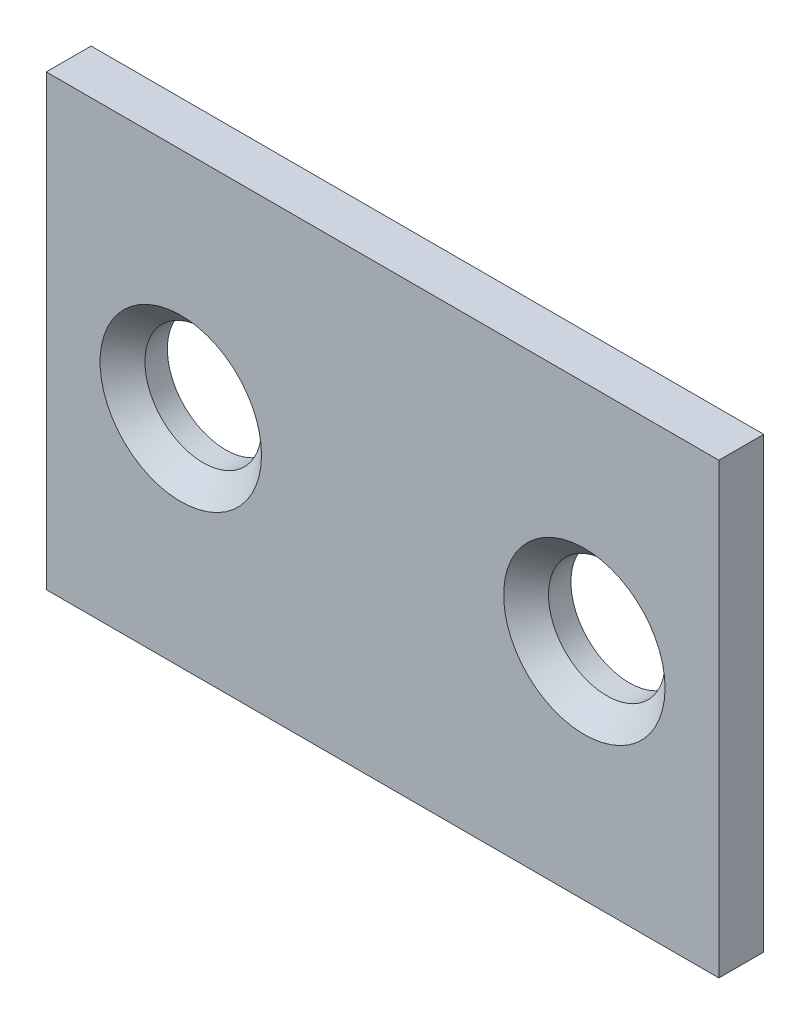
from build123d import *

# Parameters (mm, degrees)
SKETCH1_W          = 30
SKETCH1_H          = 20
BASE_FLANGE1_DEPTH = 2


# Sheet-metal steps are written as plain solids
with BuildPart() as part:
    # Sketch1 → Base-Flange1 (new body)
    with BuildSketch(Plane.XY):
        Rectangle(SKETCH1_W, SKETCH1_H)
    extrude(amount=BASE_FLANGE1_DEPTH)

    # Sketch6 → Ø5.2 (5.2) Diameter Hole1 (revolve, cut)
    with BuildSketch(Plane(origin=(-9, 0, 2), x_dir=(0, -1, 0), z_dir=(1, 0, 0))):
        Polygon((0, 0), (0, 2), (2.6, 2), (2.6, 1), (3.6, 0), align=None)
    f_5_2_5_2_diameter_hole1 = revolve(axis=Axis((-9, 0, 8.35), (0, 0, -1)), mode=Mode.SUBTRACT)

    # Mirror1: Ø5.2 (5.2) Diameter Hole1 across plane
    add(f_5_2_5_2_diameter_hole1.mirror(Plane(origin=(0, 0, 0), x_dir=(0, 0, 1), z_dir=(1, 0, 0))), mode=Mode.SUBTRACT)


solid = part.part
